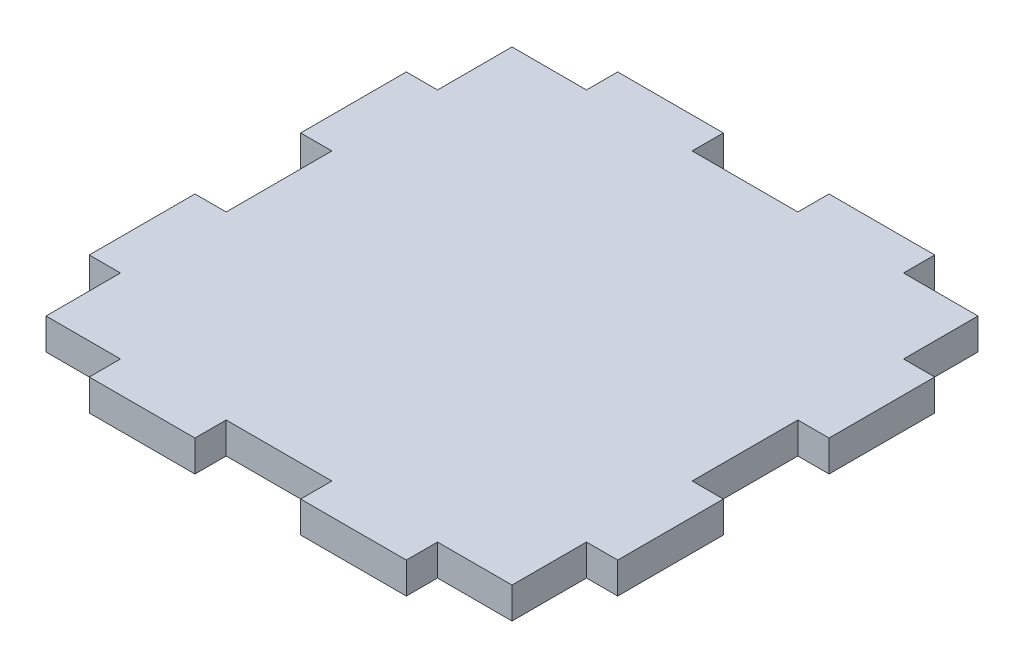
from build123d import *

# Parameters (mm, degrees)
SKETCH1_W           = 50.8
SKETCH1_H           = 50.8
BOSS_EXTRUDE1_DEPTH = 3
SKETCH2_W           = 10.16
SKETCH2_H           = 3
SKETCH2_W_2         = 3
SKETCH2_H_2         = 10.16
CUT_EXTRUDE1_DEPTH  = 72.904659098


with BuildPart() as part:
    # Sketch1 → Boss-Extrude1 (new body)
    with BuildSketch(Plane(origin=(0, 0, 0), x_dir=(1, 0, 0), z_dir=(0, 1, 0))):
        with Locations((25.4, 25.4)):
            Rectangle(SKETCH1_W, SKETCH1_H)
    extrude(amount=BOSS_EXTRUDE1_DEPTH)

    # Sketch2 → Cut-Extrude1 (cut, through all)
    with BuildSketch(Plane(origin=(0, 3, 0), x_dir=(1, 0, 0), z_dir=(0, 1, 0))):
        Polygon((50.8, 50.8), (40.64, 50.8), (40.64, 47.8), (47.8, 47.8), (47.8, 40.64), (50.8, 40.64), align=None)
        with Locations((25.4, 49.3)):
            Rectangle(SKETCH2_W, SKETCH2_H)
        Polygon((10.16, 47.8), (10.16, 50.8), (0, 50.8), (0, 40.64), (3, 40.64), (3, 47.8), align=None)
        with Locations((49.3, 25.4)):
            Rectangle(SKETCH2_W_2, SKETCH2_H_2)
        Polygon((50.8, 10.16), (47.8, 10.16), (47.8, 3), (40.64, 3), (40.64, 0), (50.8, 0), align=None)
        with Locations((1.5, 25.4)):
            Rectangle(SKETCH2_W_2, SKETCH2_H_2)
        Polygon((3, 10.16), (0, 10.16), (0, 0), (10.16, 0), (10.16, 3), (3, 3), align=None)
        with Locations((25.4, 1.5)):
            Rectangle(SKETCH2_W, SKETCH2_H)
    extrude(amount=-CUT_EXTRUDE1_DEPTH, mode=Mode.SUBTRACT)


solid = part.part
